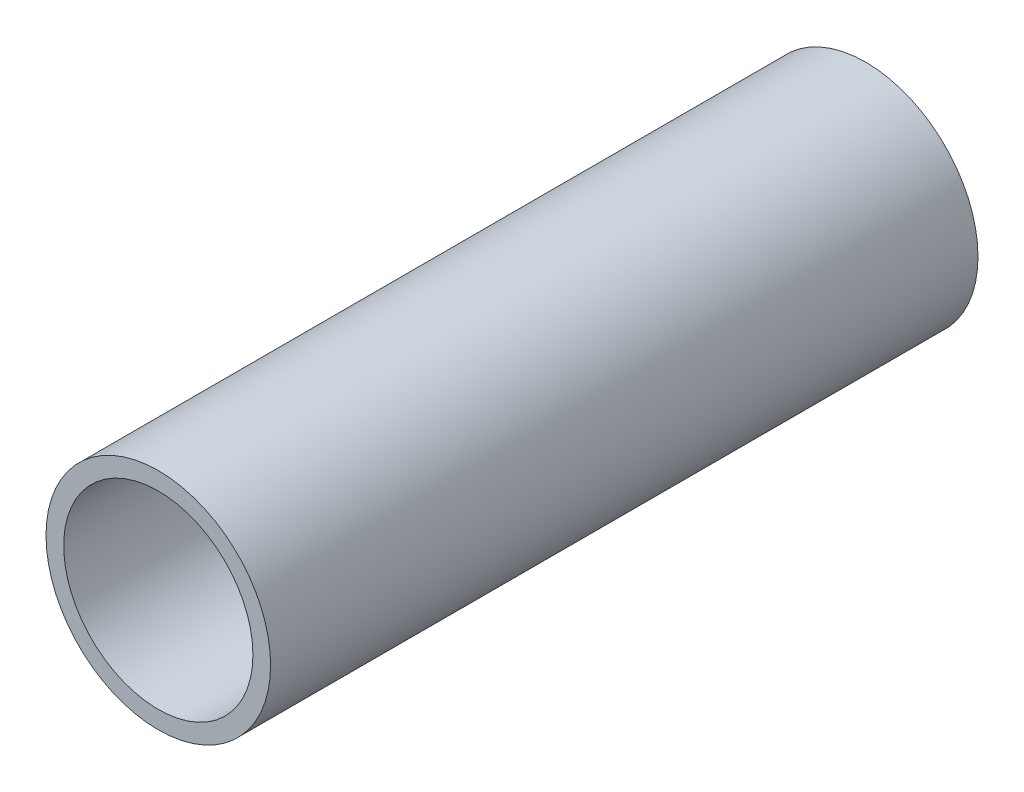
from build123d import *

# Parameters (mm, degrees)
SKETCH1_R           = 12.7
SKETCH1_R_2         = 10.7
BOSS_EXTRUDE1_DEPTH = 80


with BuildPart() as part:
    # Sketch1 → Boss-Extrude1 (new body)
    with BuildSketch(Plane.XY):
        Circle(SKETCH1_R)
        Circle(SKETCH1_R_2, mode=Mode.SUBTRACT)
    extrude(amount=BOSS_EXTRUDE1_DEPTH)


solid = part.part
